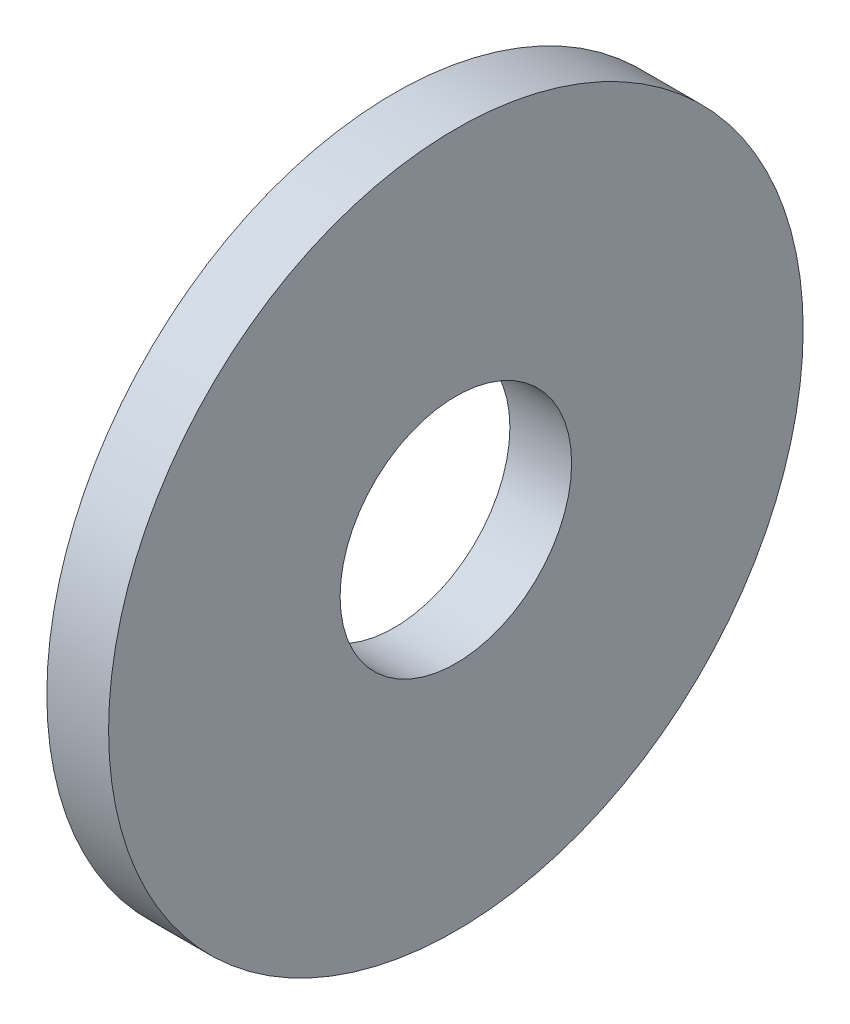
from build123d import *

# Parameters (mm, degrees)
SKETCH1_R           = 4.5
SKETCH1_R_2         = 1.5
BOSS_EXTRUDE1_DEPTH = 0.8


with BuildPart() as part:
    # Sketch1 → Boss-Extrude1 (new body)
    with BuildSketch(Plane(origin=(0, 0, 0), x_dir=(0, 0, -1), z_dir=(1, 0, 0))):
        Circle(SKETCH1_R)
        Circle(SKETCH1_R_2, mode=Mode.SUBTRACT)
    extrude(amount=BOSS_EXTRUDE1_DEPTH)


solid = part.part
